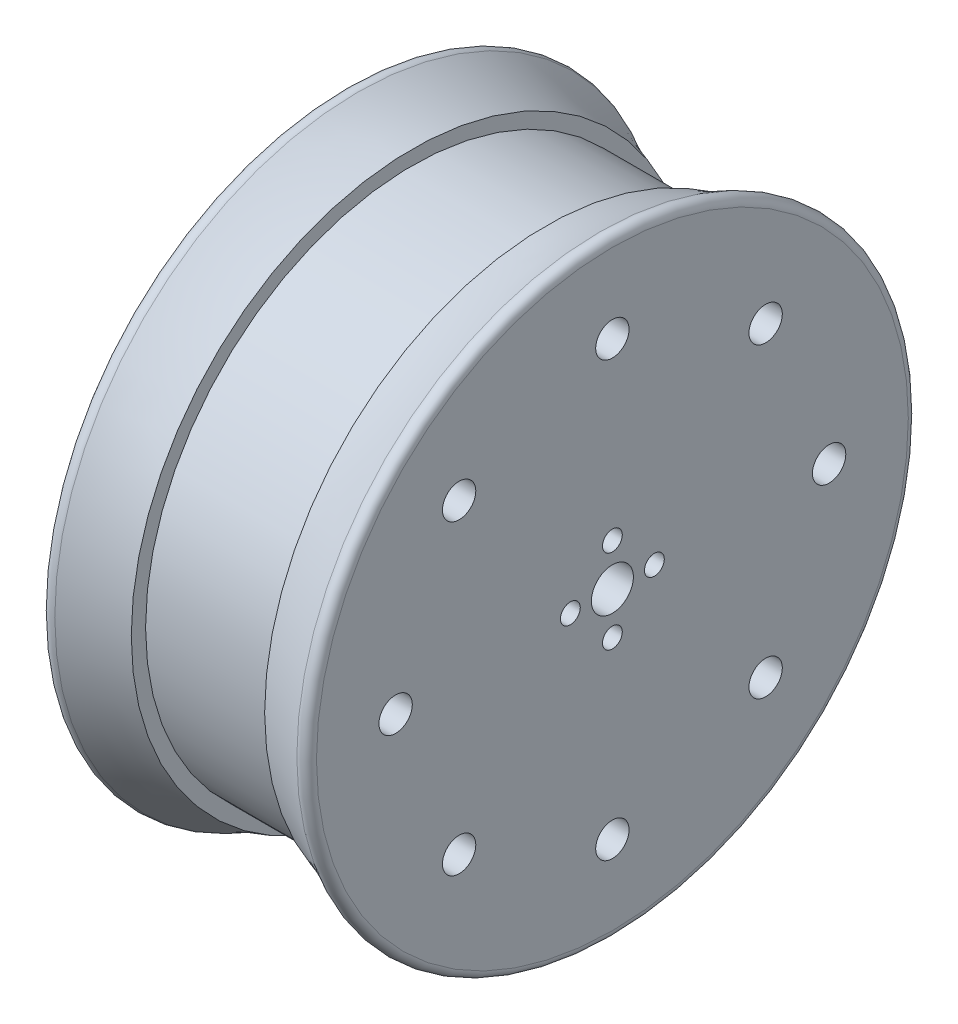
from build123d import *

# Parameters (mm, degrees)
FLOWER_R               = 4
FLOWER_R_2             = 1.885
MOUNTING_DEPTH         = 98.854112643
FILLET1_R              = 1.5875
SKETCH1_R              = 3.175
MASS_AND_BALANCE_DEPTH = 97.414821501


with BuildPart() as part:
    # Wheel Arc → Wheel (revolve)
    with BuildSketch(Plane.XY):
        with BuildLine():
            Line((-25.4, 0), (25.4, 0))
            Line((25.4, 0), (25.4, -59.138766309))
            ThreePointArc((25.4, -59.138766309), (19.25570916, -55.8663236), (12.7, -53.524557464))
            Line((12.7, -53.524557464), (12.7, -50.8))
            Line((12.7, -50.8), (-12.7, -50.8))
            Line((-12.7, -50.8), (-12.7, -53.524557464))
            ThreePointArc((-12.7, -53.524557464), (-19.25570916, -55.8663236), (-25.4, -59.138766309))
            Line((-25.4, -59.138766309), (-25.4, 0))
        make_face()
    revolve(axis=Axis((-40.905271883, 0, 0), (1, 0, 0)))

    # Flower → Mounting (cut, through all)
    with BuildSketch(Plane(origin=(25.4, 0, 0), x_dir=(0, 0, -1), z_dir=(1, 0, 0))):
        Circle(FLOWER_R)
        with Locations((0, 8)):
            Circle(FLOWER_R_2)
        with Locations((8, 0)):
            Circle(FLOWER_R_2)
        with Locations((0, -8)):
            Circle(FLOWER_R_2)
        with Locations((-8, 0)):
            Circle(FLOWER_R_2)
    extrude(amount=-MOUNTING_DEPTH, mode=Mode.SUBTRACT)

    # Fillet1
    fillet1_edges = [part.edges().sort_by_distance(p)[0] for p in [
        (25.4, 59.138766309, 0),
        (-25.4, 59.138766309, 0),
    ]]
    fillet(fillet1_edges, radius=FILLET1_R)

    # Sketch1 → Mass_and_Balance (cut, through all)
    with BuildSketch(Plane(origin=(25.4, 0, 0), x_dir=(0, 0, -1), z_dir=(1, 0, 0))):
        with Locations((0, 41.275)):
            Circle(SKETCH1_R)
        with Locations((29.185832393, 29.185832393)):
            Circle(SKETCH1_R)
        with Locations((41.275, 0)):
            Circle(SKETCH1_R)
        with Locations((29.185832393, -29.185832393)):
            Circle(SKETCH1_R)
        with Locations((0, -41.275)):
            Circle(SKETCH1_R)
        with Locations((-29.185832393, -29.185832393)):
            Circle(SKETCH1_R)
        with Locations((-41.275, 0)):
            Circle(SKETCH1_R)
        with Locations((-29.185832393, 29.185832393)):
            Circle(SKETCH1_R)
    extrude(amount=-MASS_AND_BALANCE_DEPTH, mode=Mode.SUBTRACT)


solid = part.part
